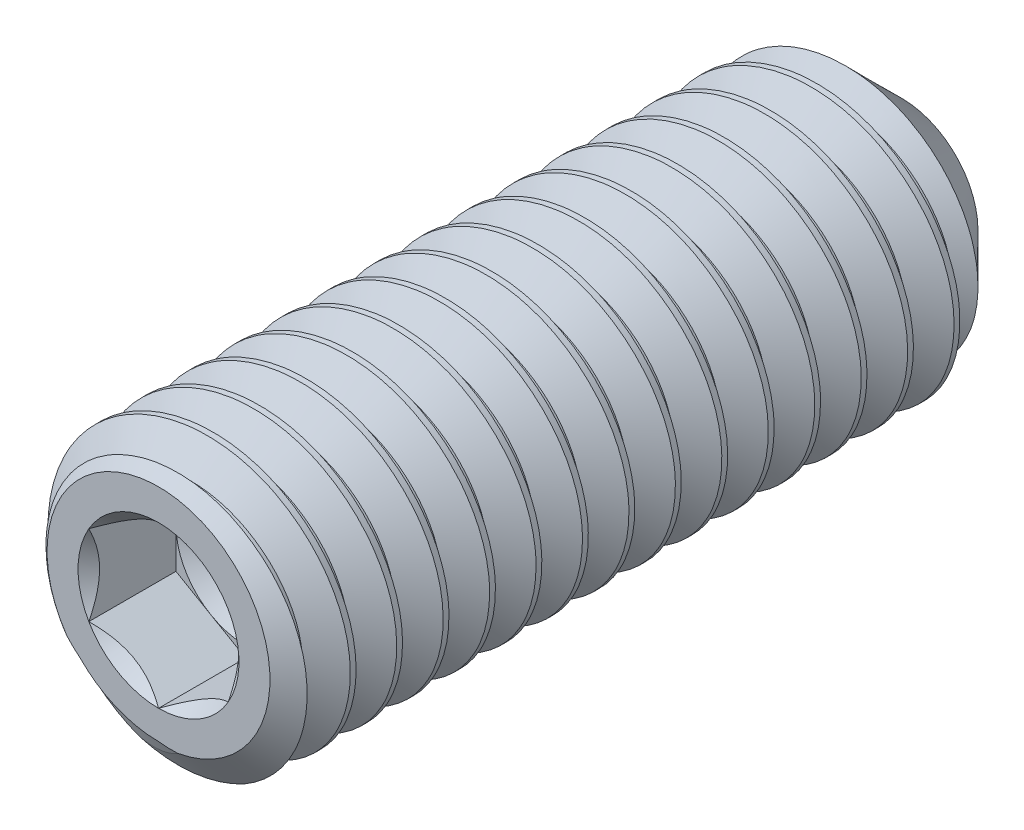
from build123d import *

# Parameters (mm, degrees)
CUT_SWEEP2_PITCH    = 0.5
CUT_EXTRUDE10_DEPTH = 0.9375


with BuildPart() as part:
    # Sketch22 → Revolve1 (revolve)
    with BuildSketch(Plane(origin=(0, 0, 0), x_dir=(0, 0, -1), z_dir=(1, 0, 0)), mode=Mode.PRIVATE) as revolve1_sk:
        Polygon((-3.7530621, 0), (-3.7530621, 1.2), (-3.542999839, 1.5), (3.568885259, 1.5), (4.2469379, 0.821947359), (3.7530621, 0), align=None)
    revolve(revolve1_sk.sketch.rotate(Axis((0, 0, -3.7530621), (0, 0, -1)), 180), axis=Axis((0, 0, -3.7530621), (0, 0, -1)))

    # Cut-Sweep2: arcs per turn and ends read off the stored shape
    # Cut-Sweep2: the profile of Sketch28 profile screwed along a right-hand helix through 17 turns, 6 arcs to a turn; built about Z, then put on its axis
    cut_sweep2_z = Axis((0, 0, 0), (0, 0, 1))
    cut_sweep2_corners = [(1.5003, -2.62e-07, -0.124826809), (1.5003, -2.62e-07, -0.562673219), (1.175240474, -2.05e-07, -0.375000014), (1.175240474, -2.05e-07, -0.312500014)]
    with BuildLine(mode=Mode.PRIVATE) as cut_sweep2_profile:
        Line(cut_sweep2_corners[0], cut_sweep2_corners[1])
        Line(cut_sweep2_corners[1], cut_sweep2_corners[2])
        Line(cut_sweep2_corners[2], cut_sweep2_corners[3])
        Line(cut_sweep2_corners[3], cut_sweep2_corners[0])
    cut_sweep2_cap = Face(cut_sweep2_profile.wire())
    cut_sweep2_turn_angles = [0, 30, 60, 90, 120, 150, 180, 210, 240, 270, 300, 330, 360]
    cut_sweep2_turn_weights = [1, 0.8660254037844387, 1, 0.8660254037844387, 1, 0.8660254037844387, 1, 0.8660254037844387, 1, 0.8660254037844387, 1, 0.8660254037844387, 1]
    cut_sweep2_turn_rails = [Edge.make_bspline([Vector(p[0], p[1], 0).rotate(cut_sweep2_z, cut_sweep2_turn_angles[k]) / cut_sweep2_turn_weights[k] + Vector(0, 0, p[2] + CUT_SWEEP2_PITCH * cut_sweep2_turn_angles[k] / 360) for k in range(13)], [0, 0, 0, 1, 1, 2, 2, 3, 3, 4, 4, 5, 5, 6, 6, 6], 2, cut_sweep2_turn_weights) for p in cut_sweep2_corners]
    cut_sweep2_turn_sides = [Face.make_surface_from_curves(cut_sweep2_turn_rails[p[0]], cut_sweep2_turn_rails[p[1]]) for p in [(0, 1), (1, 2), (2, 3), (3, 0)]]
    cut_sweep2 = Plane(origin=(0, 0, -4.2469379), x_dir=(1, 0, 0), z_dir=(0, 0, 1)) * Solid(Shell([*[p.moved(Location((0, 0, CUT_SWEEP2_PITCH * i))) for i in range(17) for p in cut_sweep2_turn_sides], cut_sweep2_cap, cut_sweep2_cap.rotate(cut_sweep2_z, 6120).moved(Location((0, 0, CUT_SWEEP2_PITCH * 6120 / 360)))]))
    add(cut_sweep2, mode=Mode.SUBTRACT)

    # Sketch23 → Cut-Extrude10 (cut)
    with BuildSketch(Plane.XY.offset(3.7530621)):
        Polygon((0, 0.866025404), (-0.75, 0.433012702), (-0.75, -0.433012702), (0, -0.866025404), (0.75, -0.433012702), (0.75, 0.433012702), align=None)
    extrude(amount=-CUT_EXTRUDE10_DEPTH, mode=Mode.SUBTRACT)

    # Cut-Extrude11 cone 1 section (through the dimple's axis) → Cut-Extrude11 (revolve, cut)
    with BuildSketch(Plane(origin=(0, 0, 3.7530621), x_dir=(0, -1, 0), z_dir=(1, 0, 0))):
        Polygon((0, 0), (0.866025404, 0), (0, 0.866025404), align=None)
    revolve(axis=Axis((0, 0, 3.7530621), (0, 0, -1)), mode=Mode.SUBTRACT)

    # Cut-Extrude12 cone 1 section (through the dimple's axis) → Cut-Extrude12 (revolve, cut)
    with BuildSketch(Plane(origin=(0, 0, 2.8155621), x_dir=(0, -1, 0), z_dir=(1, 0, 0))):
        Polygon((0, 0), (0.75, 0), (0, 0.433012702), align=None)
    revolve(axis=Axis((0, 0, 2.8155621), (0, 0, -1)), mode=Mode.SUBTRACT)


solid = part.part
